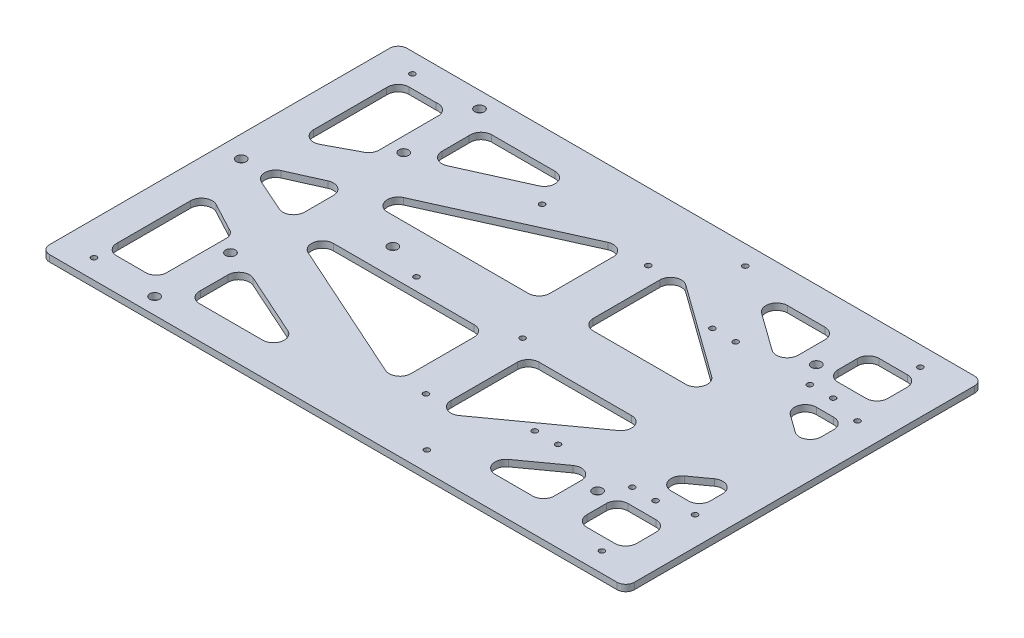
from build123d import *

# Parameters (mm, degrees)
CROQUIS1_W                     = 270
CROQUIS1_H                     = 165
SALIENTE_EXTRUIR1_DEPTH        = 3
REDONDEO1_R                    = 4
CROQUIS2_R                     = 2.25
CORTAR_EXTRUIR1_DEPTH          = 159.241113495
CROQUIS3_R                     = 2.25
CORTAR_EXTRUIR2_DEPTH          = 159.241113495
TALADRO_ROSCADO_M31_D          = 2.5
TALADRO_ROSCADO_M31_DEPTH      = 8.5
TALADRO_ROSCADO_M31_TIP        = 0.751075774
CROQUIS9_R                     = 2.25
CORTAR_EXTRUIR4_DEPTH          = 4
TALADRO_ROSCADO_M33_AT_2_COUNT = 2
TALADRO_ROSCADO_M33_AT_2_PITCH = 49
TALADRO_ROSCADO_M33_AT_3_COUNT = 2
TALADRO_ROSCADO_M33_AT_3_PITCH = 75.927597091
TALADRO_ROSCADO_M33_AT_4_COUNT = 2
TALADRO_ROSCADO_M33_AT_4_PITCH = 58
TALADRO_ROSCADO_M33_AT_5_COUNT = 2
TALADRO_ROSCADO_M33_AT_5_PITCH = 100.2193197
TALADRO_ROSCADO_M33_AT_6_COUNT = 2
TALADRO_ROSCADO_M33_AT_6_PITCH = 145.054665519
TALADRO_ROSCADO_M33_AT_7_COUNT = 2
TALADRO_ROSCADO_M33_AT_7_PITCH = 171.623501537
TALADRO_ROSCADO_M33_AT_8_COUNT = 2
TALADRO_ROSCADO_M33_AT_8_PITCH = 135.859053184
CORTAR_EXTRUIR6_DEPTH          = 159.241113495
SIMETR_A9_OUTLINE_R            = 1.25
SIMETR_A9_DEPTH                = 3
CORTAR_EXTRUIR7_DEPTH          = 159.241113495
TALADRO_ROSCADO_M34_D          = 2.5
TALADRO_ROSCADO_M34_DEPTH      = 8.5
TALADRO_ROSCADO_M34_TIP        = 0.751075774
TALADRO_ROSCADO_M35_OUTLINE_R  = 1.25
TALADRO_ROSCADO_M35_DEPTH      = 3


# Read off the part's stored shape, not the designer's step: Simetría9, Taladro roscado M35
with BuildPart() as part:
    # Croquis1 → Saliente-Extruir1 (new body)
    with BuildSketch(Plane(origin=(0, 0, 0), x_dir=(1, 0, 0), z_dir=(0, 1, 0))):
        Rectangle(CROQUIS1_W, CROQUIS1_H)
    extrude(amount=SALIENTE_EXTRUIR1_DEPTH)

    # Redondeo1
    redondeo1_edges = [part.edges().sort_by_distance(p)[0] for p in [
        (-135, 1.5, -82.5),
        (135, 1.5, -82.5),
        (135, 1.5, 82.5),
        (-135, 1.5, 82.5),
    ]]
    fillet(redondeo1_edges, radius=REDONDEO1_R)

    # Croquis2 → Cortar-Extruir1 (cut, through all)
    with BuildSketch(Plane(origin=(0, 3, 0), x_dir=(1, 0, 0), z_dir=(0, 1, 0))):
        with Locations(Location((90, 50.5, 0), (0, 0, 270))):
            Circle(CROQUIS2_R)
    cortar_extruir1 = extrude(amount=-CORTAR_EXTRUIR1_DEPTH, mode=Mode.SUBTRACT)

    # Simetría1: Cortar-Extruir1 across plane
    add(cortar_extruir1.mirror(Plane.XY), mode=Mode.SUBTRACT)

    # Croquis3 → Cortar-Extruir2 (cut, through all)
    with BuildSketch(Plane(origin=(0, 3, 0), x_dir=(1, 0, 0), z_dir=(0, 1, 0))):
        with Locations(Location((-90, 75, 0), (0, 0, 270))):
            Circle(CROQUIS3_R)
        with Locations(Location((-90, -75, 0), (0, 0, 90))):
            Circle(CROQUIS3_R)
    extrude(amount=-CORTAR_EXTRUIR2_DEPTH, mode=Mode.SUBTRACT)

    # Taladro roscado M31
    with Locations(Plane(origin=(0, 3, 0), x_dir=(1, 0, 0), z_dir=(0, 1, 0))):
        with Locations((-119.5, 73.5), (34.2, 73.5), (115, 73.5), (115, -73.5), (34.2, -73.5), (-119.5, -73.5)):
            Hole(TALADRO_ROSCADO_M31_D / 2, depth=TALADRO_ROSCADO_M31_DEPTH)
            with Locations((0, 0, -(TALADRO_ROSCADO_M31_DEPTH + TALADRO_ROSCADO_M31_TIP / 2))):  # 118° drill point
                Cone(0, TALADRO_ROSCADO_M31_D / 2, TALADRO_ROSCADO_M31_TIP, mode=Mode.SUBTRACT)

    # Croquis9 → Cortar-Extruir4 (cut)
    with BuildSketch(Plane(origin=(0, 3, 0), x_dir=(1, 0, 0), z_dir=(0, 1, 0))):
        with Locations(Location((-125, 0, 0), (0, 0, 270))):
            Circle(CROQUIS9_R)
        with Locations(Location((-90, 40, 0), (0, 0, 270))):
            Circle(CROQUIS9_R)
        with Locations(Location((-55, 0, 0), (0, 0, 270))):
            Circle(CROQUIS9_R)
        with Locations(Location((-90, -40, 0), (0, 0, 270))):
            Circle(CROQUIS9_R)
    extrude(amount=-CORTAR_EXTRUIR4_DEPTH, mode=Mode.SUBTRACT)

    # Croquis13 → Taladro roscado M33 (revolve, cut)
    with BuildSketch(Plane(origin=(-37.418266085, 3, -51.303477383), x_dir=(0, 0, 1), z_dir=(1, 0, 0))):
        Polygon((0, 0), (0, 9.251075774), (1.25, 8.5), (1.25, 0), align=None)
    taladro_roscado_m33 = revolve(axis=Axis((-37.418266085, 9.35, -51.303477383), (0, -1, 0)), mode=Mode.SUBTRACT)

    # Taladro roscado M33 at 2: Taladro roscado M33 ×2
    with Locations(*[(i * TALADRO_ROSCADO_M33_AT_2_PITCH, 0, 0) for i in range(1, TALADRO_ROSCADO_M33_AT_2_COUNT)]):
        add(taladro_roscado_m33, mode=Mode.SUBTRACT)

    # Taladro roscado M33 at 3: Taladro roscado M33 ×2
    with Locations(*[Vector(0.64535164916821, 0, 0.7638856255460446) * (i * TALADRO_ROSCADO_M33_AT_3_PITCH) for i in range(1, TALADRO_ROSCADO_M33_AT_3_COUNT)]):
        add(taladro_roscado_m33, mode=Mode.SUBTRACT)

    # Taladro roscado M33 at 4: Taladro roscado M33 ×2
    with Locations(*[(0, 0, i * TALADRO_ROSCADO_M33_AT_4_PITCH) for i in range(1, TALADRO_ROSCADO_M33_AT_4_COUNT)]):
        add(taladro_roscado_m33, mode=Mode.SUBTRACT)

    # Taladro roscado M33 at 5: Taladro roscado M33 ×2
    with Locations(*[Vector(0.994701085409218, 0, 0.10280929279848038) * (i * TALADRO_ROSCADO_M33_AT_5_PITCH) for i in range(1, TALADRO_ROSCADO_M33_AT_5_COUNT)]):
        add(taladro_roscado_m33, mode=Mode.SUBTRACT)

    # Taladro roscado M33 at 6: Taladro roscado M33 ×2
    with Locations(*[Vector(0.9974740596393399, 0, 0.07103168551157087) * (i * TALADRO_ROSCADO_M33_AT_6_PITCH) for i in range(1, TALADRO_ROSCADO_M33_AT_6_COUNT)]):
        add(taladro_roscado_m33, mode=Mode.SUBTRACT)

    # Taladro roscado M33 at 7: Taladro roscado M33 ×2
    with Locations(*[Vector(0.8430562527245126, 0, 0.5378253942889856) * (i * TALADRO_ROSCADO_M33_AT_7_PITCH) for i in range(1, TALADRO_ROSCADO_M33_AT_7_COUNT)]):
        add(taladro_roscado_m33, mode=Mode.SUBTRACT)

    # Taladro roscado M33 at 8: Taladro roscado M33 ×2
    with Locations(*[Vector(0.7337624085302012, 0, 0.679406158220514) * (i * TALADRO_ROSCADO_M33_AT_8_PITCH) for i in range(1, TALADRO_ROSCADO_M33_AT_8_COUNT)]):
        add(taladro_roscado_m33, mode=Mode.SUBTRACT)

    # Croquis14 → Cortar-Extruir6 (cut, through all)
    with BuildSketch(Plane(origin=(0, 3, 0), x_dir=(1, 0, 0), z_dir=(0, 1, 0))):
        with BuildLine():
            Line((-120, 28.398750886), (-120, 62.017874677))
            ThreePointArc((-120, 62.017874677), (-118.717549208, 65.869409223), (-115, 67.5))
            Line((-115, 67.5), (-102.5, 67.5))
            ThreePointArc((-102.5, 67.5), (-98.23701973, 66.153409719), (-96.755059563, 61.935578496))
            Line((-96.755059563, 61.935578496), (-96.709895244, 34.964136309))
            ThreePointArc((-96.709895244, 34.964136309), (-97.777163786, 32.278384366), (-100.152290907, 30.631843508))
            Line((-100.152290907, 30.631843508), (-112.652290907, 23.984199718))
            ThreePointArc((-112.652290907, 23.984199718), (-117.575019858, 24.11281193), (-120, 28.398750886))
        make_face()
        with BuildLine():
            Line((-77.059060961, 67.5), (-47.609439547, 67.5))
            ThreePointArc((-47.609439547, 67.5), (-42.720638048, 63.548627628), (-45.55882662, 57.939847961))
            Line((-45.55882662, 57.939847961), (-74.683432869, 44.84307102))
            ThreePointArc((-74.683432869, 44.84307102), (-79.445942677, 45.202554623), (-81.734038787, 49.394850452))
            Line((-81.734038787, 49.394850452), (-81.755080593, 61.960696316))
            ThreePointArc((-81.755080593, 61.960696316), (-80.598973856, 65.740800117), (-77.059060961, 67.5))
        make_face()
        with BuildLine():
            Line((115, 67.5), (102.028239036, 67.5))
            ThreePointArc((102.028239036, 67.5), (98.49270513, 66.035533906), (97.028239036, 62.5))
            Line((97.028239036, 62.5), (97.028239036, 53.5))
            ThreePointArc((97.028239036, 53.5), (98.49270513, 49.964466094), (102.028239036, 48.5))
            Line((102.028239036, 48.5), (115, 48.5))
            ThreePointArc((115, 48.5), (118.535533906, 49.964466094), (120, 53.5))
            Line((120, 53.5), (120, 62.5))
            ThreePointArc((120, 62.5), (118.535533906, 66.035533906), (115, 67.5))
        make_face()
        with BuildLine():
            Line((0, 46.729253569), (0, 17.5))
            ThreePointArc((0, 17.5), (-1.464466094, 13.964466094), (-5, 12.5))
            Line((-5, 12.5), (-70, 12.5))
            ThreePointArc((-70, 12.5), (-74.888801499, 16.451372372), (-72.050612927, 22.060152039))
            Line((-72.050612927, 22.060152039), (-7.050612927, 51.289405608))
            ThreePointArc((-7.050612927, 51.289405608), (-2.284587014, 50.927649967), (0, 46.729253569))
        make_face()
        with BuildLine():
            Line((25, 12.5), (67.709590661, 12.5))
            ThreePointArc((67.709590661, 12.5), (72.468444519, 15.96594982), (70.629718908, 21.558676018))
            Line((70.629718908, 21.558676018), (27.920128247, 52.287288393))
            ThreePointArc((27.920128247, 52.287288393), (22.719719451, 52.678367494), (20, 48.228612375))
            Line((20, 48.228612375), (20, 17.5))
            ThreePointArc((20, 17.5), (21.464466094, 13.964466094), (25, 12.5))
        make_face()
        with BuildLine():
            Line((56.796518667, 58.441323982), (74.108110788, 45.986013695))
            ThreePointArc((74.108110788, 45.986013695), (79.308519585, 45.594934594), (82.028239036, 50.044689713))
            Line((82.028239036, 50.044689713), (82.028239036, 62.5))
            ThreePointArc((82.028239036, 62.5), (80.563772942, 66.035533906), (77.028239036, 67.5))
            Line((77.028239036, 67.5), (59.716646914, 67.5))
            ThreePointArc((59.716646914, 67.5), (54.957793056, 64.03405018), (56.796518667, 58.441323982))
        make_face()
        with BuildLine():
            Line((104.052999524, 24.441323982), (112.079871753, 18.666165721))
            ThreePointArc((112.079871753, 18.666165721), (117.280280549, 18.27508662), (120, 22.724841739))
            Line((120, 22.724841739), (120, 28.5))
            ThreePointArc((120, 28.5), (118.535533906, 32.035533906), (115, 33.5))
            Line((115, 33.5), (106.973127771, 33.5))
            ThreePointArc((106.973127771, 33.5), (102.214273912, 30.03405018), (104.052999524, 24.441323982))
        make_face()
        with BuildLine():
            Line((77.028239036, -67.5), (59.716646914, -67.5))
            ThreePointArc((59.716646914, -67.5), (54.957793056, -64.03405018), (56.796518667, -58.441323982))
            Line((56.796518667, -58.441323982), (74.108110788, -45.986013695))
            ThreePointArc((74.108110788, -45.986013695), (79.308519585, -45.594934594), (82.028239036, -50.044689713))
            Line((82.028239036, -50.044689713), (82.028239036, -62.5))
            ThreePointArc((82.028239036, -62.5), (80.563772942, -66.035533906), (77.028239036, -67.5))
        make_face()
        with BuildLine():
            Line((20, -48.228612375), (20, -17.5))
            ThreePointArc((20, -17.5), (21.464466094, -13.964466094), (25, -12.5))
            Line((25, -12.5), (67.709590661, -12.5))
            ThreePointArc((67.709590661, -12.5), (72.468444519, -15.96594982), (70.629718908, -21.558676018))
            Line((70.629718908, -21.558676018), (27.920128247, -52.287288393))
            ThreePointArc((27.920128247, -52.287288393), (22.719719451, -52.678367494), (20, -48.228612375))
        make_face()
        with BuildLine():
            Line((-5, -12.5), (-70, -12.5))
            ThreePointArc((-70, -12.5), (-74.888801499, -16.451372372), (-72.050612927, -22.060152039))
            Line((-72.050612927, -22.060152039), (-7.050612927, -51.289405608))
            ThreePointArc((-7.050612927, -51.289405608), (-2.284587014, -50.927649967), (0, -46.729253569))
            Line((0, -46.729253569), (0, -17.5))
            ThreePointArc((0, -17.5), (-1.464466094, -13.964466094), (-5, -12.5))
        make_face()
        with BuildLine():
            Line((-45.55882662, -57.939847961), (-74.683432869, -44.84307102))
            ThreePointArc((-74.683432869, -44.84307102), (-79.445942677, -45.202554623), (-81.734038787, -49.394850452))
            Line((-81.734038787, -49.394850452), (-81.755080593, -61.960696316))
            ThreePointArc((-81.755080593, -61.960696316), (-80.598973856, -65.740800117), (-77.059060961, -67.5))
            Line((-77.059060961, -67.5), (-47.609439547, -67.5))
            ThreePointArc((-47.609439547, -67.5), (-42.720638048, -63.548627628), (-45.55882662, -57.939847961))
        make_face()
        with BuildLine():
            Line((-120, -28.398750886), (-120, -62.017874677))
            ThreePointArc((-120, -62.017874677), (-118.717549208, -65.869409223), (-115, -67.5))
            Line((-115, -67.5), (-102.5, -67.5))
            ThreePointArc((-102.5, -67.5), (-98.23701973, -66.153409719), (-96.755059563, -61.935578496))
            Line((-96.755059563, -61.935578496), (-96.709895244, -34.964136309))
            ThreePointArc((-96.709895244, -34.964136309), (-97.777163786, -32.278384366), (-100.152290907, -30.631843508))
            Line((-100.152290907, -30.631843508), (-112.652290907, -23.984199718))
            ThreePointArc((-112.652290907, -23.984199718), (-117.575019858, -24.11281193), (-120, -28.398750886))
        make_face()
        with BuildLine():
            Line((120, -53.5), (120, -62.5))
            ThreePointArc((120, -62.5), (118.535533906, -66.035533906), (115, -67.5))
            Line((115, -67.5), (102.028239036, -67.5))
            ThreePointArc((102.028239036, -67.5), (98.49270513, -66.035533906), (97.028239036, -62.5))
            Line((97.028239036, -62.5), (97.028239036, -53.5))
            ThreePointArc((97.028239036, -53.5), (98.49270513, -49.964466094), (102.028239036, -48.5))
            Line((102.028239036, -48.5), (115, -48.5))
            ThreePointArc((115, -48.5), (118.535533906, -49.964466094), (120, -53.5))
        make_face()
        with BuildLine():
            Line((106.973127771, -33.5), (115, -33.5))
            ThreePointArc((115, -33.5), (118.535533906, -32.035533906), (120, -28.5))
            Line((120, -28.5), (120, -22.724841739))
            ThreePointArc((120, -22.724841739), (117.280280549, -18.27508662), (112.079871753, -18.666165721))
            Line((112.079871753, -18.666165721), (104.052999524, -24.441323982))
            ThreePointArc((104.052999524, -24.441323982), (102.214273912, -30.03405018), (106.973127771, -33.5))
        make_face()
    extrude(amount=-CORTAR_EXTRUIR6_DEPTH, mode=Mode.SUBTRACT)

    # Simetría9 outline → Simetría9 (cut)
    with BuildSketch(Plane(origin=(0, 0, 0), x_dir=(1, 0, 0), z_dir=(0, 1, 0))):
        with Locations((11.581733915, -51.303477383)):
            Circle(SIMETR_A9_OUTLINE_R)
    extrude(amount=SIMETR_A9_DEPTH, mode=Mode.SUBTRACT)

    # Croquis15 → Cortar-Extruir7 (cut, through all)
    with BuildSketch(Plane(origin=(0, 3, 0), x_dir=(1, 0, 0), z_dir=(0, 1, 0))):
        with BuildLine():
            Line((-111.134338329, -4.563579441), (-96.167012767, -11.263990176))
            ThreePointArc((-96.167012767, -11.263990176), (-91.405111599, -10.896532153), (-89.124038787, -6.700410735))
            Line((-89.124038787, -6.700410735), (-89.124038787, 6.700410735))
            ThreePointArc((-89.124038787, 6.700410735), (-91.405111599, 10.896532153), (-96.167012767, 11.263990176))
            Line((-96.167012767, 11.263990176), (-111.134338329, 4.563579441))
            ThreePointArc((-111.134338329, 4.563579441), (-114.091364348, 0), (-111.134338329, -4.563579441))
        make_face()
    extrude(amount=-CORTAR_EXTRUIR7_DEPTH, mode=Mode.SUBTRACT)

    # Taladro roscado M34
    with Locations(Plane(origin=(0, 3, 0), x_dir=(1, 0, 0), z_dir=(0, 1, 0))):
        with Locations((96.5, 41), (96.5, -41), (51.5, -41), (51.5, 41)):
            Hole(TALADRO_ROSCADO_M34_D / 2, depth=TALADRO_ROSCADO_M34_DEPTH)
            with Locations((0, 0, -(TALADRO_ROSCADO_M34_DEPTH + TALADRO_ROSCADO_M34_TIP / 2))):  # 118° drill point
                Cone(0, TALADRO_ROSCADO_M34_D / 2, TALADRO_ROSCADO_M34_TIP, mode=Mode.SUBTRACT)

    # Taladro roscado M35 outline → Taladro roscado M35 (cut)
    with BuildSketch(Plane(origin=(0, 0, 0), x_dir=(1, 0, 0), z_dir=(0, 1, 0))):
        with Locations((122, -37.5)):
            Circle(TALADRO_ROSCADO_M35_OUTLINE_R)
        with Locations((122, 37.5)):
            Circle(TALADRO_ROSCADO_M35_OUTLINE_R)
    extrude(amount=TALADRO_ROSCADO_M35_DEPTH, mode=Mode.SUBTRACT)


solid = part.part
